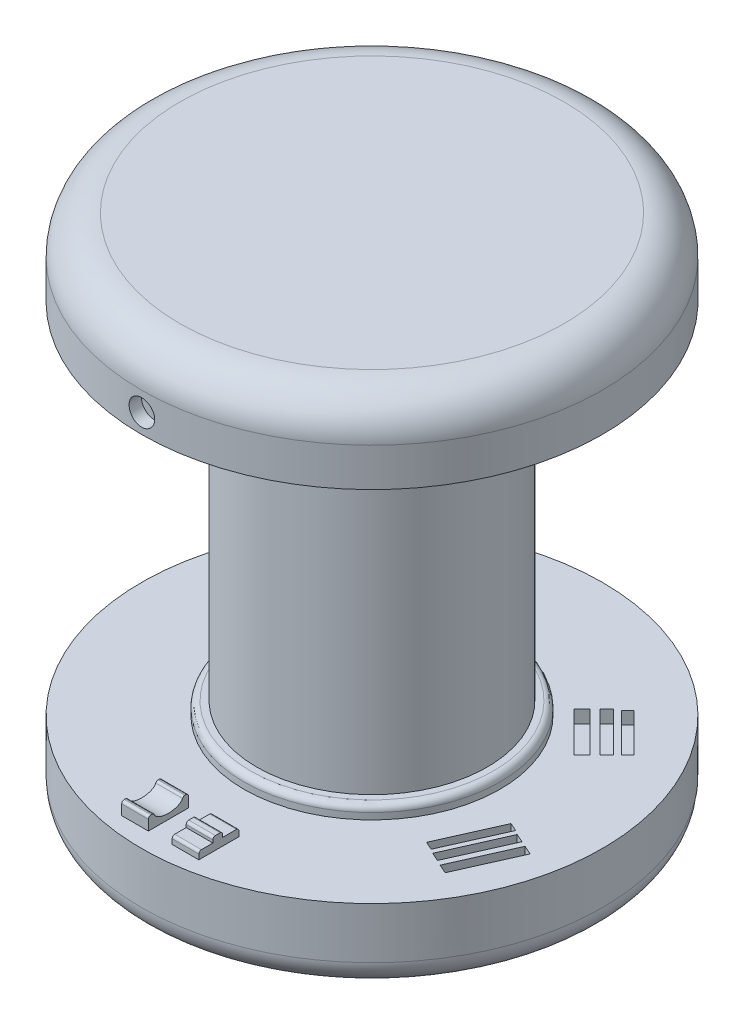
from build123d import *

# Parameters (mm, degrees)
SKETCH1_R           = 180
BOSS_EXTRUDE1_DEPTH = 60
FILLET1_R           = 20
SKETCH2_R           = 100
BOSS_EXTRUDE3_DEPTH = 10
SKETCH3_R           = 90
BOSS_EXTRUDE4_DEPTH = 270
SKETCH4_R           = 180
BOSS_EXTRUDE5_DEPTH = 60
FILLET2_R           = 30
BOSS_EXTRUDE6_START = 10
SKETCH6_R           = 100
BOSS_EXTRUDE6_DEPTH = 10
FILLET3_R           = 5
SKETCH9_W           = 20.845427705
SKETCH9_H           = 31.268141557
BOSS_EXTRUDE7_DEPTH = 10
SKETCH10_R          = 10
CUT_EXTRUDE2_DEPTH  = 10
CUT_EXTRUDE3_START  = 10
SKETCH12_R          = 10
CUT_EXTRUDE3_DEPTH  = 10
SKETCH13_RX         = 11.260558061
SKETCH13_RY         = 5.777483036
CUT_EXTRUDE4_DEPTH  = 30
SKETCH14_W          = 10.93815799
SKETCH14_H          = 4.07197177
SKETCH14_W_2        = 12.726253657
CUT_EXTRUDE5_DEPTH  = 30
FILLET4_START       = -31
FILLET4_DEPTH       = 62
FILLET4_START_2     = -9.089801569
FILLET4_2_DEPTH     = 40.089801569
CUT_EXTRUDE6_DEPTH  = 10
CUT_EXTRUDE7_DEPTH  = 10


with BuildPart() as part:
    # Sketch1 → Boss-Extrude1 (new body)
    with BuildSketch(Plane(origin=(0, 0, 0), x_dir=(1, 0, 0), z_dir=(0, 1, 0))):
        with Locations(Location((0, 0, 0), (0, 0, 90))):
            Circle(SKETCH1_R)
    extrude(amount=BOSS_EXTRUDE1_DEPTH)

    # Fillet1
    fillet1_edges = [part.edges().sort_by_distance(p)[0] for p in [
        (0, 0, 180),
    ]]
    fillet(fillet1_edges, radius=FILLET1_R)

    # Sketch2 → Boss-Extrude3 (add)
    with BuildSketch(Plane(origin=(0, 60, 0), x_dir=(1, 0, 0), z_dir=(0, 1, 0))):
        with Locations(Location((0, 0, 0), (0, 0, 270))):
            Circle(SKETCH2_R)
    extrude(amount=BOSS_EXTRUDE3_DEPTH)

    # Sketch3 → Boss-Extrude4 (add)
    with BuildSketch(Plane(origin=(0, 70, 0), x_dir=(1, 0, 0), z_dir=(0, 1, 0))):
        with Locations(Location((0, 0, 0), (0, 0, 270))):
            Circle(SKETCH3_R)
    extrude(amount=BOSS_EXTRUDE4_DEPTH)

    # Sketch4 → Boss-Extrude5 (add)
    with BuildSketch(Plane(origin=(0, 340, 0), x_dir=(1, 0, 0), z_dir=(0, 1, 0))):
        with Locations(Location((0, 0, 0), (0, 0, 90))):
            Circle(SKETCH4_R)
    extrude(amount=BOSS_EXTRUDE5_DEPTH)

    # Fillet2
    fillet2_edges = [part.edges().sort_by_distance(p)[0] for p in [
        (0, 400, 180),
    ]]
    fillet(fillet2_edges, radius=FILLET2_R)

    # Sketch6 → Boss-Extrude6 (add)
    with BuildSketch(Plane.XZ.offset(-340).offset(BOSS_EXTRUDE6_START)):
        with Locations(Location((0, 0, 0), (0, 0, 90))):
            Circle(SKETCH6_R)
    extrude(amount=-BOSS_EXTRUDE6_DEPTH)

    # Fillet3
    fillet3_edges = [part.edges().sort_by_distance(p)[0] for p in [
        (0, 330, -100),
        (0, 70, -100),
    ]]
    fillet(fillet3_edges, radius=FILLET3_R)

    # Sketch9 → Boss-Extrude7 (add)
    with BuildSketch(Plane(origin=(0, 60, 0), x_dir=(1, 0, 0), z_dir=(0, 1, 0))):
        with Locations((-19.512515422, -149.90314923)):
            Rectangle(SKETCH9_W, SKETCH9_H)
        with Locations((19.656209668, -149.671177345)):
            Rectangle(SKETCH9_W, SKETCH9_H)
    extrude(amount=BOSS_EXTRUDE7_DEPTH)

    # Sketch10 → Cut-Extrude2 (cut)
    with BuildSketch(Plane.XY.offset(180)):
        with Locations((0, 355)):
            Circle(SKETCH10_R)
    extrude(amount=-CUT_EXTRUDE2_DEPTH, mode=Mode.SUBTRACT)

    # Sketch12 → Cut-Extrude3 (cut)
    with BuildSketch(Plane.XY.offset(-180).offset(CUT_EXTRUDE3_START)):
        with Locations((0, 355)):
            Circle(SKETCH12_R)
    extrude(amount=-CUT_EXTRUDE3_DEPTH, mode=Mode.SUBTRACT)

    # Sketch13 → Cut-Extrude4 (cut)
    with BuildSketch(Plane.ZY.offset(29.935229274)):
        with Locations((149.903149231, 70)):
            Ellipse(SKETCH13_RX, SKETCH13_RY)
    extrude(amount=-CUT_EXTRUDE4_DEPTH, mode=Mode.SUBTRACT)

    # Sketch14 → Cut-Extrude5 (cut)
    with BuildSketch(Plane(origin=(30.07892352, 0, 0), x_dir=(0, 0, -1), z_dir=(1, 0, 0))):
        with Locations((-159.836169129, 67.964014115)):
            Rectangle(SKETCH14_W, SKETCH14_H)
        with Locations((-140.400233395, 67.964014115)):
            Rectangle(SKETCH14_W_2, SKETCH14_H)
    extrude(amount=-CUT_EXTRUDE5_DEPTH, mode=Mode.SUBTRACT)

    # Fillet4: read off the stored shape, not the designer's step
    # Fillet4 outline → Fillet4 (cut)
    with BuildSketch(Plane.YZ.offset(FILLET4_START)):
        with BuildLine():
            Line((70, 165.537220009), (68, 165.537220009))
            ThreePointArc((68, 165.537220009), (69.414213562, 164.951433572), (70, 163.537220009))
            Line((70, 163.537220009), (70, 165.537220009))
        make_face()
        with BuildLine():
            Line((70, 161.163707292), (70, 162.751420247))
            ThreePointArc((70, 162.751420247), (69.666591866, 161.645765891), (68.777528446, 160.908745692))
            add(Edge.make_bspline(
                [(68.777528446, 160.908745692), (69.381765186, 161.163707292), (70, 161.163707292)],
                knots=[6.055563227, 6.055563227, 6.055563227, 6.283185307, 6.283185307, 6.283185307], degree=2, weights=[0.927415097, 0.957557219, 1]))
        make_face()
        with BuildLine():
            Line((70, 154.367090134), (68, 154.367090134))
            ThreePointArc((68, 154.367090134), (69.414213562, 153.781303696), (70, 152.367090134))
            Line((70, 152.367090134), (70, 154.367090134))
        make_face()
        with BuildLine():
            add(Edge.make_bspline(
                [(70, 138.642591169), (69.381765186, 138.642591169), (68.777528446, 138.897552769)],
                knots=[3.141592654, 3.141592654, 3.141592654, 3.369214734, 3.369214734, 3.369214734], degree=2, weights=[1, 0.957557219, 0.927415097]))
            ThreePointArc((68.777528446, 138.897552769), (69.666591866, 138.16053257), (70, 137.054878214))
            Line((70, 137.054878214), (70, 138.642591169))
        make_face()
        with BuildLine():
            ThreePointArc((70, 148.763360224), (69.414213562, 147.349146661), (68, 146.763360224))
            Line((68, 146.763360224), (70, 146.763360224))
            Line((70, 146.763360224), (70, 148.763360224))
        make_face()
        with BuildLine():
            Line((65.92802823, 134.269078452), (64.862948862, 134.269078452))
            ThreePointArc((64.862948862, 134.269078452), (64.409662828, 134.095965635), (63.92802823, 134.037106567))
            Line((63.92802823, 134.037106567), (65.92802823, 134.037106567))
            Line((65.92802823, 134.037106567), (65.92802823, 134.269078452))
        make_face()
        with BuildLine():
            ThreePointArc((70, 136.269078452), (69.414213562, 134.85486489), (68, 134.269078452))
            Line((68, 134.269078452), (70, 134.269078452))
            Line((70, 134.269078452), (70, 136.269078452))
        make_face()
    extrude(amount=FILLET4_DEPTH, mode=Mode.SUBTRACT)

    # Fillet4 2 outline → Fillet4 2 (cut)
    with BuildSketch(Plane.YZ.offset(FILLET4_START_2)):
        with BuildLine():
            ThreePointArc((63.92802823, 165.305248124), (65.342241792, 164.719461686), (65.92802823, 163.305248124))
            Line((65.92802823, 163.305248124), (65.92802823, 165.305248124))
            Line((65.92802823, 165.305248124), (63.92802823, 165.305248124))
        make_face()
        with BuildLine():
            Line((65.92802823, 134.269078452), (65.92802823, 136.037106567))
            ThreePointArc((65.92802823, 136.037106567), (65.641189236, 135.005079741), (64.862948862, 134.269078452))
            Line((64.862948862, 134.269078452), (65.92802823, 134.269078452))
        make_face()
    extrude(amount=FILLET4_2_DEPTH, mode=Mode.SUBTRACT)

    # Sketch22 → Cut-Extrude6 (cut)
    with BuildSketch(Plane(origin=(0, 60, 0), x_dir=(1, 0, 0), z_dir=(0, 1, 0))):
        Polygon((127.423760752, -18.872499432), (107.1351894, -64.521784974), (113.629623838, -67.40820028), (133.91819519, -21.758914738), align=None)
        Polygon((137.220873331, -23.883738258), (116.932301979, -69.5330238), (123.677729052, -72.530991388), (143.966300404, -26.881705846), align=None)
        Polygon((148.265392154, -28.776757418), (127.858476847, -74.692316859), (134.98259987, -77.858593758), (155.389515177, -31.943034317), align=None)
    extrude(amount=-CUT_EXTRUDE6_DEPTH, mode=Mode.SUBTRACT)

    # Sketch24 → Cut-Extrude7 (cut)
    with BuildSketch(Plane(origin=(0, 60, 0), x_dir=(1, 0, 0), z_dir=(0, 1, 0))):
        Polygon((111.713779985, 58.505093082), (105.578926162, 52.370239259), (74.729375507, 83.219789913), (80.86422933, 89.354643737), align=None)
        Polygon((115.569973817, 62.361286914), (84.720423162, 93.210837569), (90.154150834, 98.644565241), (121.003701489, 67.795014586), align=None)
        Polygon((93.930128704, 100.831618279), (123.985216943, 70.77653004), (128.873539941, 75.664853038), (98.818451702, 105.719941277), align=None)
    extrude(amount=-CUT_EXTRUDE7_DEPTH, mode=Mode.SUBTRACT)


solid = part.part
